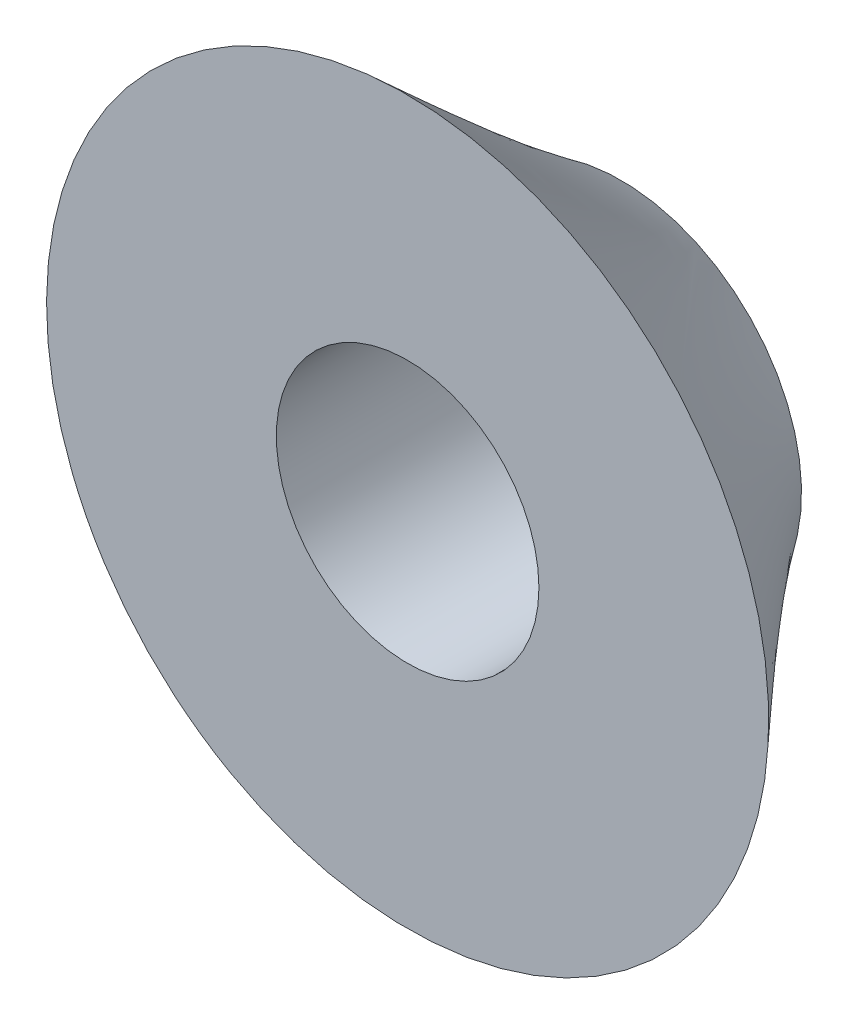
from build123d import *

# Parameters (mm, degrees)
CORTE_EXTRUS_O1_DEPTH      = 17.859715469
CORTE_EXTRUS_O1_DEPTH_BACK = 17.859715469
ESBO_O3_R                  = 4


with BuildPart() as part:
    # Loft2: read off the stored shape, not the designer's step
    # Loft2: loft between two sections, ruled curve by curve
    loft2_from = [
        Edge.make_bspline([(2.294779925, 4.998398253, 0), (-7.702016581, 9.587958103, 0), (-12.291576431, -0.408838403, 0), (-2.294779925, -4.998398253, 0), (7.702016581, -9.587958103, 0), (12.291576431, 0.408838403, 0), (2.294779925, 4.998398253, 0)], [0, 0, 0, 0, 0.5, 0.5, 0.5, 1, 1, 1, 1], 3, [1, 0.333333333, 0.333333333, 1, 0.333333333, 0.333333333, 1]),
    ]
    loft2_to = [
        Edge.make_bspline([(8.274034308, 7.248472686, 6.5), (-6.222911064, 23.796541301, 6.5), (-22.770979679, 9.29959593, 6.5), (-8.274034308, -7.248472686, 6.5), (6.222911064, -23.796541301, 6.5), (22.770979679, -9.29959593, 6.5), (8.274034308, 7.248472686, 6.5)], [0, 0, 0, 0, 0.5, 0.5, 0.5, 1, 1, 1, 1], 3, [1, 0.333333333, 0.333333333, 1, 0.333333333, 0.333333333, 1]),
    ]
    loft2 = Solid(Shell([*[Face.make_surface_from_curves(loft2_from[k], loft2_to[k]) for k in range(1)], Face(Wire(loft2_from)), Face(Wire(loft2_to))]))
    add(loft2)

    # Esboço3 → Corte-extrusão1 (cut, two sides: drawn at the far end of the back side and taken through both)
    with BuildSketch(Plane.XY.offset(-CORTE_EXTRUS_O1_DEPTH_BACK)):
        Circle(ESBO_O3_R)
    extrude(amount=CORTE_EXTRUS_O1_DEPTH + CORTE_EXTRUS_O1_DEPTH_BACK, mode=Mode.SUBTRACT)


solid = part.part
